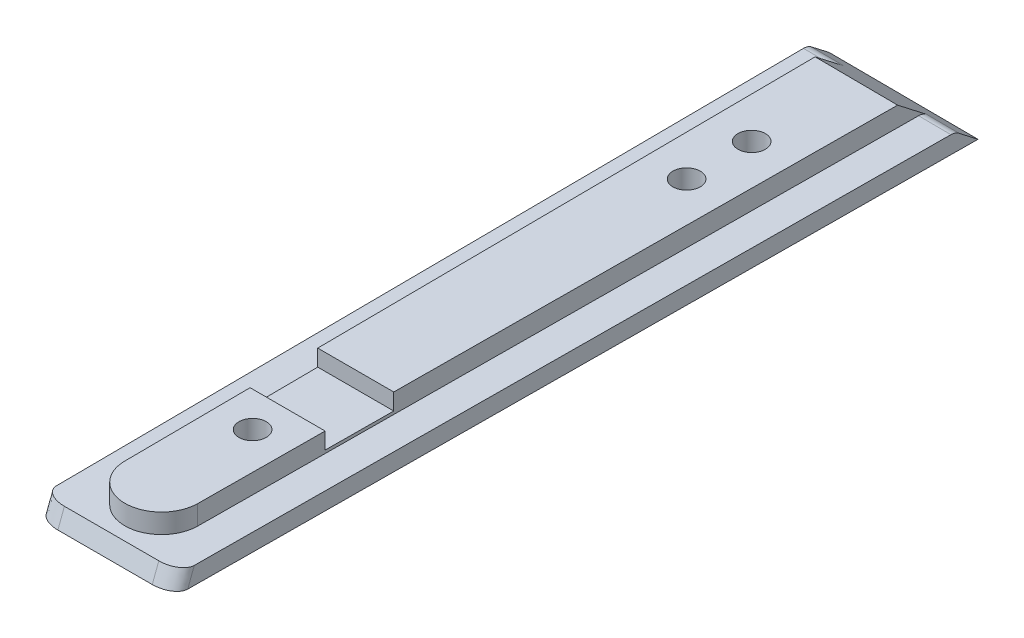
from build123d import *

# Parameters (mm, degrees)
BOSS_EXTRUDE1_DEPTH     = 4
BOSS_EXTRUDE2_DEPTH     = 4.5
CUT_EXTRUDE1_DEPTH      = 99.435547891
CUT_EXTRUDE1_DEPTH_BACK = 99.435547891
CUT_EXTRUDE2_START      = -4.5
CUT_EXTRUDE2_DEPTH      = 4.5
CUT_EXTRUDE3_DEPTH      = 95.023100537
CUT_EXTRUDE3_DEPTH_BACK = 95.023100537
CUT_EXTRUDE4_DEPTH      = 94.998158329
CUT_EXTRUDE4_DEPTH_BACK = 94.998158329
SKETCH6_W               = 15.7
SKETCH6_H               = 4.5
FILLET1_R               = 3
BOSS_EXTRUDE3_DEPTH     = 0.7
CUT_EXTRUDE5_DEPTH      = 94.967813764
CUT_EXTRUDE5_DEPTH_BACK = 94.967813764
SKETCH8_R               = 3.15


# Read off the part's stored shape, not the designer's step: Cut-Extrude2
with BuildPart() as part:
    # Sketch1 → Boss-Extrude1 (new body)
    with BuildSketch(Plane(origin=(0, 0, 0), x_dir=(1, 0, 0), z_dir=(0, 1, 0))):
        Polygon((-15.85, -91.997703776), (15.85, -91.997703776), (17.15, 91.997703776), (-17.15, 91.997703776), align=None)
    extrude(amount=BOSS_EXTRUDE1_DEPTH)

    # Sketch2 → Boss-Extrude2 (add)
    with BuildSketch(Plane(origin=(0, 4, 0), x_dir=(1, 0, 0), z_dir=(0, 1, 0))):
        Polygon((-8.349812803, -91.997703776), (8.349812803, -91.997703776), (9.649812803, 91.997703776), (-9.649812803, 91.997703776), align=None)
    extrude(amount=BOSS_EXTRUDE2_DEPTH)

    # Sketch3 → Cut-Extrude1 (cut, two sides: drawn at the far end of the back side and taken through both)
    with BuildSketch(Plane(origin=(16.499176365, 0, 0.116573177), x_dir=(0.007065217391304343, 0, -0.9999750410401319), z_dir=(0.999975041040132, 0, 0.0070652173913043435)).offset(-CUT_EXTRUDE1_DEPTH_BACK)):
        Polygon((92.116576087, 0), (81.116576087, 8.5), (92.116576087, 8.5), align=None)
    extrude(amount=CUT_EXTRUDE1_DEPTH + CUT_EXTRUDE1_DEPTH_BACK, mode=Mode.SUBTRACT)

    # Cut-Extrude2 outline → Cut-Extrude2 (cut)
    with BuildSketch(Plane(origin=(0, 8.5, 0), x_dir=(1, 0, 0), z_dir=(0, 1, 0)).offset(CUT_EXTRUDE2_START)):
        with BuildLine():
            ThreePointArc((8.440819946, -79.117014334), (0.10345841, -87.440771539), (-8.439329356, -79.327984806))
            Line((-8.439329356, -79.327984806), (-8.349812803, -91.997703776))
            Line((-8.349812803, -91.997703776), (8.349812803, -91.997703776))
            Line((8.349812803, -91.997703776), (8.440819946, -79.117014334))
        make_face()
    extrude(amount=CUT_EXTRUDE2_DEPTH, mode=Mode.SUBTRACT)

    # Sketch5 → Cut-Extrude3 (cut, two sides: drawn at the far end of the back side and taken through both)
    with BuildSketch(Plane(origin=(0, 0, 0.056470136), x_dir=(0, 0, -1), z_dir=(1, 0, 0)).offset(-CUT_EXTRUDE3_DEPTH_BACK)):
        Polygon((-91.941233639, 0), (-90.441233639, 4), (-91.941233639, 4), align=None)
    extrude(amount=CUT_EXTRUDE3_DEPTH + CUT_EXTRUDE3_DEPTH_BACK, mode=Mode.SUBTRACT)

    # Sketch6 → Cut-Extrude4 (cut, two sides: drawn at the far end of the back side and taken through both)
    with BuildSketch(Plane(origin=(0, 0, 0.030994299), x_dir=(0, 0, -1), z_dir=(1, 0, 0)).offset(-CUT_EXTRUDE4_DEPTH_BACK)):
        with Locations((-42.060436633, 6.25)):
            Rectangle(SKETCH6_W, SKETCH6_H)
    extrude(amount=CUT_EXTRUDE4_DEPTH + CUT_EXTRUDE4_DEPTH_BACK, mode=Mode.SUBTRACT)

    # Fillet1
    fillet1_edges = [part.edges().sort_by_distance(p)[0] for p in [
        (13.363520706, 4, -86.847856952),
        (-13.364854981, 4, -87.03670345),
    ]]
    fillet(fillet1_edges, radius=FILLET1_R)

    # Fillet3
    # an asymmetric fillet: 5, 3 mm, written as the material it takes off along each edge
    with BuildSketch(Plane(origin=(-15.891485902, 15.657877718, 86.125999632), x_dir=(-0.006615348832314233, -0.3511311249673921, -0.9363029265355098), z_dir=(0.002480817730747878, -0.9363262962659619, 0.3511223610997357))) as fillet3_piece_1:
        with BuildLine():
            Bezier((2.966988077, 0), (0, 0), (-0.032946278, 4.980153892), weights=[1, 0.709441812, 1])
            Line((-0.032946278, 4.980153892), (0, 0))
            Line((0, 0), (2.966988077, 0))
        make_face()
    extrude(amount=29.173329366, mode=Mode.SUBTRACT)
    with BuildSketch(Plane(origin=(15.819112189, -11.657877718, 96.36940792), x_dir=(-0.9999969227669587, 0.002322862025529483, -0.0008710732595747153), z_dir=(0.002480817730747878, 0.9363262962659619, -0.3511223610997357))) as fillet3_piece_2:
        with BuildLine():
            Bezier((4.98026287, 0), (0, 0), (-0.019627722, -2.966923154), weights=[1, 0.709441812, 1])
            Line((-0.019627722, -2.966923154), (0, 0))
            Line((0, 0), (4.98026287, 0))
        make_face()
    extrude(amount=29.173329366, mode=Mode.SUBTRACT)

    # Sketch7 → Boss-Extrude3 (add)
    with BuildSketch(Plane(origin=(0, 4, 0), x_dir=(1, 0, 0), z_dir=(0, 1, 0))):
        Polygon((-8.64695693, -49.941430932), (-8.757883612, -34.241430932), (8.757883612, -34.241430932), (8.64695693, -49.941430932), align=None)
    extrude(amount=BOSS_EXTRUDE3_DEPTH)

    # Sketch8 → Cut-Extrude5 (cut, two sides: drawn at the far end of the back side and taken through both)
    with BuildSketch(Plane(origin=(0, 8.5, 0), x_dir=(1, 0, 0), z_dir=(0, 1, 0)).offset(-CUT_EXTRUDE5_DEPTH_BACK)):
        with Locations(Location((0, -58.002296224, 0), (0, 0, 270))):
            Circle(SKETCH8_R)
        with Locations(Location((0, 56.997703776, 0), (0, 0, 270))):
            Circle(SKETCH8_R)
        with Locations(Location((0, 41.997703776, 0), (0, 0, 270))):
            Circle(SKETCH8_R)
    extrude(amount=CUT_EXTRUDE5_DEPTH + CUT_EXTRUDE5_DEPTH_BACK, mode=Mode.SUBTRACT)


solid = part.part
